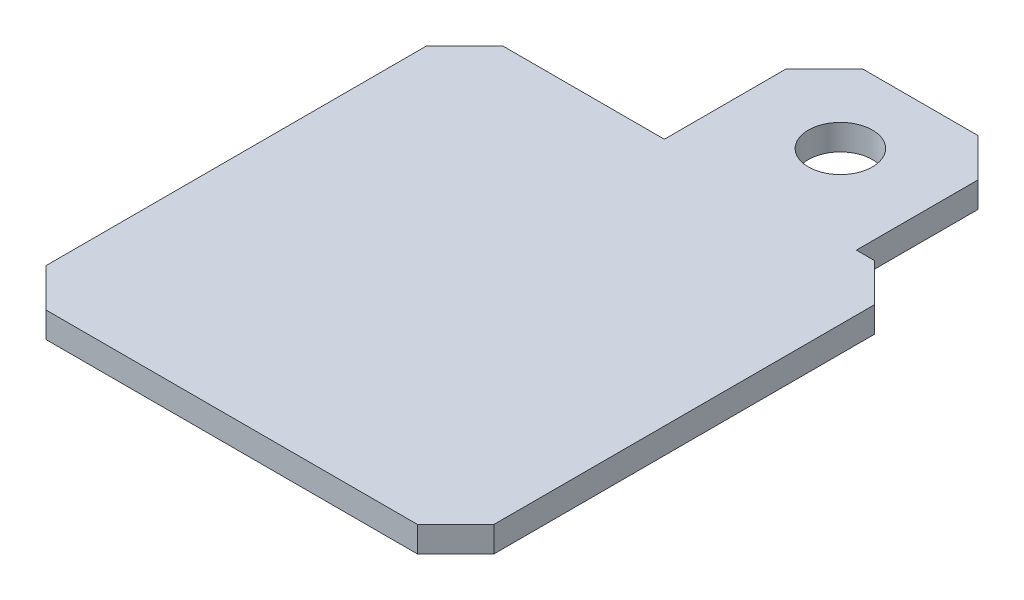
from build123d import *

# Parameters (mm, degrees)
SKETCH1_R           = 2.5
BOSS_EXTRUDE1_DEPTH = 2
CHAMFER1_SIZE       = 3


with BuildPart() as part:
    # Sketch1 → Boss-Extrude1 (new body)
    with BuildSketch(Plane(origin=(0, 0, 0), x_dir=(1, 0, 0), z_dir=(0, 1, 0))):
        Polygon((-17.5, 17.5), (-17.5, -18.2), (17.5, -18.2), (17.5, 17.5), (13.1, 17.5), (13.1, 30), (-1.9, 30), (-1.9, 17.5), align=None)
        with Locations((5.6, 23.75)):
            Circle(SKETCH1_R, mode=Mode.SUBTRACT)
    extrude(amount=BOSS_EXTRUDE1_DEPTH)

    # Chamfer1
    chamfer1_edges = [part.edges().sort_by_distance(p)[0] for p in [
        (13.1, 1, -30),
        (-1.9, 1, -30),
        (17.5, 1, 18.2),
        (17.5, 1, -17.5),
        (-17.5, 1, 18.2),
        (-17.5, 1, -17.5),
    ]]
    chamfer(chamfer1_edges, length=CHAMFER1_SIZE)


solid = part.part
